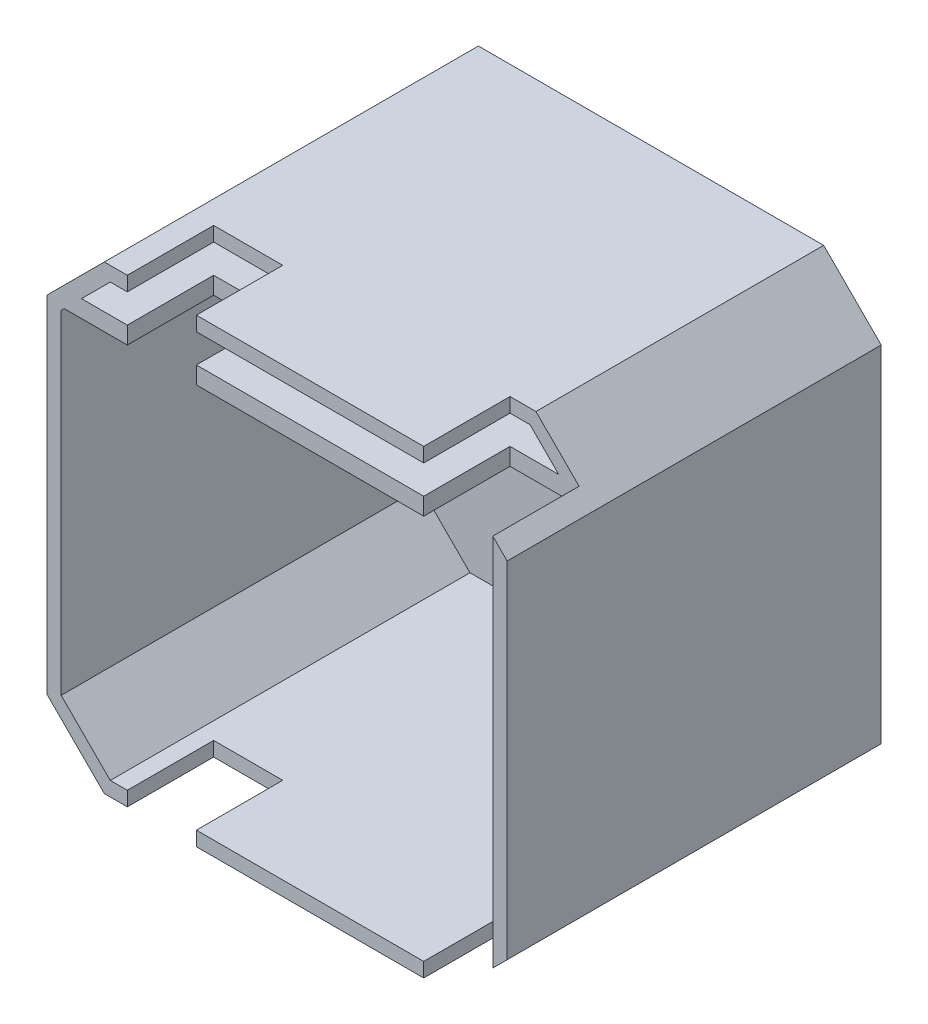
from build123d import *

# Parameters (mm, degrees)
BOSS_EXTRUDE1_DEPTH             = 65
SKETCH2_R                       = 7.5
BOSS_EXTRUDE2_DEPTH             = 2.5
BOSS_EXTRUDE3_REACH             = 88.168
SKETCH3_W                       = 65
SKETCH3_H                       = 3
BOSS_EXTRUDE3_DIRECTION_2_REACH = 88.168
CUT_EXTRUDE2_REACH              = 124.042
SKETCH6_R                       = 1.75
CUT_EXTRUDE3_REACH              = 86.299
CUT_EXTRUDE4_REACH              = 86.299
FILLET1_R                       = 2.5
FILLET2_R                       = 5
CUT_EXTRUDE5_DEPTH              = 111.566721937
CUT_EXTRUDE5_DEPTH_BACK         = 111.566721937
SKETCH9_W                       = 12
SKETCH9_H                       = 32.949220019
SKETCH9_H_2                     = 17.949220019


with BuildPart() as part:
    # Sketch1 → Boss-Extrude1 (new body)
    with BuildSketch(Plane.XY):
        Polygon((-40, 30), (-30, 40), (30, 40), (40, 30), (40, -30), (30, -40), (-30, -40), (-40, -30), align=None)
        Polygon((-37.5, 28.964466094), (-28.964466094, 37.5), (28.964466094, 37.5), (37.5, 28.964466094), (37.5, -28.964466094), (28.964466094, -37.5), (-28.964466094, -37.5), (-37.5, -28.964466094), align=None, mode=Mode.SUBTRACT)
    extrude(amount=BOSS_EXTRUDE1_DEPTH)

    # Sketch2 → Boss-Extrude2 (add)
    with BuildSketch(Plane.XY):
        Polygon((37.5, 28.964466094), (28.964466094, 37.5), (-28.964466094, 37.5), (-37.5, 28.964466094), (-37.5, -28.964466094), (-28.964466094, -37.5), (28.964466094, -37.5), (37.5, -28.964466094), align=None)
        Circle(SKETCH2_R, mode=Mode.SUBTRACT)
    extrude(amount=BOSS_EXTRUDE2_DEPTH)

    # Boss-Extrude3: up to this plane
    boss_extrude3_end = Plane(origin=(28.964466094, 37.5, 65), z_dir=(-0.7071067811865476, -0.7071067811865476, 0))
    # Sketch3 → Boss-Extrude3 (add, up to the surface)
    with BuildSketch(Plane(origin=(0, 0, 0), x_dir=(0, 0, -1), z_dir=(1, 0, 0)), mode=Mode.PRIVATE) as boss_extrude3_sk1:
        with Locations((-32.5, 31)):
            Rectangle(SKETCH3_W, SKETCH3_H)
    boss_extrude3_tool1 = split(extrude(boss_extrude3_sk1.sketch, amount=BOSS_EXTRUDE3_REACH, mode=Mode.PRIVATE), bisect_by=boss_extrude3_end, keep=Keep.BOTH, mode=Mode.PRIVATE)
    add(boss_extrude3_tool1.solids().sort_by_distance((0, 31, 32.5))[0])

    # Boss-Extrude3 direction 2: up to this plane
    boss_extrude3_direction_2_end = Plane(origin=(-37.5, 28.964466094, 65), z_dir=(0.707106781186547, -0.7071067811865481, 0))
    # Sketch3 → Boss-Extrude3 direction 2 (add, up to the surface)
    with BuildSketch(Plane(origin=(0, 0, 0), x_dir=(0, 0, -1), z_dir=(1, 0, 0)), mode=Mode.PRIVATE) as boss_extrude3_direction_2_sk1:
        with Locations((-32.5, 31)):
            Rectangle(SKETCH3_W, SKETCH3_H)
    boss_extrude3_direction_2_tool1 = split(extrude(boss_extrude3_direction_2_sk1.sketch, amount=-BOSS_EXTRUDE3_DIRECTION_2_REACH, mode=Mode.PRIVATE), bisect_by=boss_extrude3_direction_2_end, keep=Keep.BOTH, mode=Mode.PRIVATE)
    add(boss_extrude3_direction_2_tool1.solids().sort_by_distance((0, 31, 32.5))[0])

    # Sketch6 → Cut-Extrude2 (cut, up to next)
    with BuildSketch(Plane(origin=(0, 29.5, -27), x_dir=(-1, 0, 0), z_dir=(0, -1, 0)), mode=Mode.PRIVATE) as cut_extrude2_sk1:
        with Locations(Location((0, -72, 0), (0, 0, 90))):
            Circle(SKETCH6_R)
    cut_extrude2_tool1 = extrude(cut_extrude2_sk1.sketch, amount=-CUT_EXTRUDE2_REACH, mode=Mode.PRIVATE) & part.part
    # Sketch6 → Cut-Extrude2 (cut, up to next)
    with BuildSketch(Plane(origin=(0, 29.5, -27), x_dir=(-1, 0, 0), z_dir=(0, -1, 0)), mode=Mode.PRIVATE) as cut_extrude2_sk2:
        with Locations(Location((30, -37, 0), (0, 0, 90))):
            Circle(SKETCH6_R)
    cut_extrude2_tool2 = extrude(cut_extrude2_sk2.sketch, amount=-CUT_EXTRUDE2_REACH, mode=Mode.PRIVATE) & part.part
    add(cut_extrude2_tool1.solids().sort_by_distance((0, 29.5, 45))[0], mode=Mode.SUBTRACT)
    add(cut_extrude2_tool2.solids().sort_by_distance((-30, 29.5, 10))[0], mode=Mode.SUBTRACT)

    # Sketch7 → Cut-Extrude3 (cut, up to next)
    with BuildSketch(Plane.XY.offset(2.5), mode=Mode.PRIVATE) as cut_extrude3_sk1:
        Polygon((-33.964466094, 32.5), (-28.964466094, 37.5), (28.964466094, 37.5), (33.964466094, 32.5), align=None)
    cut_extrude3_tool1 = extrude(cut_extrude3_sk1.sketch, amount=-CUT_EXTRUDE3_REACH, mode=Mode.PRIVATE) & part.part
    add(cut_extrude3_tool1.solids().sort_by_distance((0, 34.933788, 2.5))[0], mode=Mode.SUBTRACT)

    # Sketch8 → Cut-Extrude4 (cut, up to next)
    with BuildSketch(Plane.XY.offset(2.5), mode=Mode.PRIVATE) as cut_extrude4_sk1:
        with BuildLine():
            Line((-5, 7.5), (0, 7.5))
            Line((0, 7.5), (-7.5, 0))
            ThreePointArc((-7.5, 0), (-8.440285268, 7.256939094), (-15, 10.5))
            Line((-15, 10.5), (-25, 10.5))
            Line((-25, 10.5), (-25, 19.5))
            Line((-25, 19.5), (-5, 19.5))
            Line((-5, 19.5), (-5, 7.5))
        make_face()
    cut_extrude4_tool1 = extrude(cut_extrude4_sk1.sketch, amount=-CUT_EXTRUDE4_REACH, mode=Mode.PRIVATE) & part.part
    add(cut_extrude4_tool1.solids().sort_by_distance((-13.255262, 13.384188, 2.5))[0], mode=Mode.SUBTRACT)

    # Fillet1
    fillet1_edges = [part.edges().sort_by_distance(p)[0] for p in [
        (-25, 10.5, 1.25),
        (-25, 19.5, 1.25),
        (-5, 19.5, 1.25),
    ]]
    fillet(fillet1_edges, radius=FILLET1_R)

    # Fillet2
    fillet2_edges = [part.edges().sort_by_distance(p)[0] for p in [
        (-5, 7.5, 1.25),
    ]]
    fillet(fillet2_edges, radius=FILLET2_R - 0.0001)  # a hair under: the kernel refuses the full size

    # Sketch9 → Cut-Extrude5 (cut, two sides: drawn at the far end of the back side and taken through both)
    with BuildSketch(Plane(origin=(0, 40, 0), x_dir=(1, 0, 0), z_dir=(0, 1, 0)).offset(-CUT_EXTRUDE5_DEPTH_BACK)):
        with Locations((31.5, -66.474610009)):
            Rectangle(SKETCH9_W, SKETCH9_H)
        with Locations((-20, -58.97461001)):
            Rectangle(SKETCH9_W, SKETCH9_H_2)
    extrude(amount=CUT_EXTRUDE5_DEPTH + CUT_EXTRUDE5_DEPTH_BACK, mode=Mode.SUBTRACT)


solid = part.part
